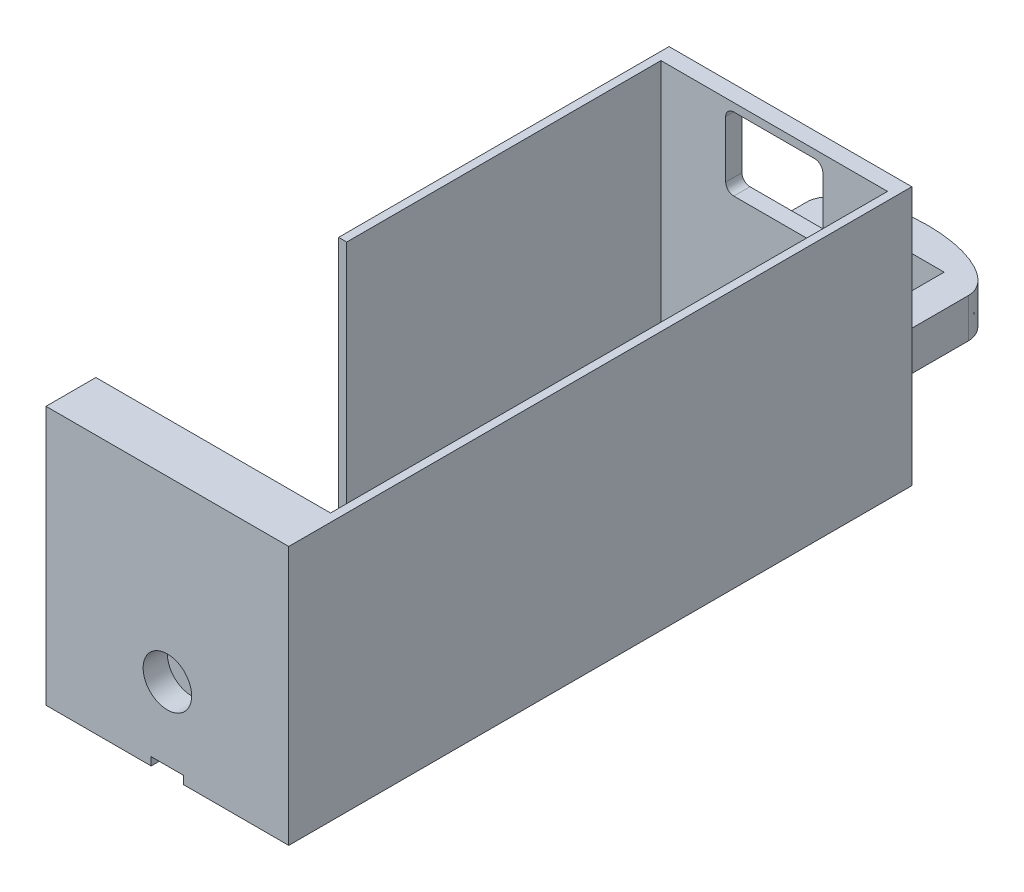
from build123d import *

# Parameters (mm, degrees)
ESQUISSE1_W              = 30
ESQUISSE1_H              = 32
BOSS_EXTRU_2_DEPTH       = 77
ESQUISSE2_W              = 28
ESQUISSE2_H              = 68.8370016
ENL_V_MAT_EXTRU_4_DEPTH  = 30
ESQUISSE3_W              = 12
ESQUISSE3_H              = 9
ENL_V_MAT_EXTRU_5_DEPTH  = 87.884981441
ESQUISSE5_W              = 20
ESQUISSE5_H              = 4.856303455
BOSS_EXTRU_3_DEPTH       = 16
ESQUISSE6_W              = 12
ESQUISSE6_H              = 12
ENL_V_MAT_EXTRU_6_DEPTH  = 6
ESQUISSE7_W              = 30
ESQUISSE7_H              = 30
ENL_V_MAT_EXTRU_7_DEPTH  = 6
CONG_3_SIZE              = 5
CONG_3_SIZE_2            = 10
CONG_5_SIZE              = 5
CONG_5_SIZE_2            = 10
ESQUISSE10_W             = 4
ESQUISSE10_H             = 1
ENL_V_MAT_EXTRU_9_DEPTH  = 89.617154096
ESQUISSE16_R             = 3
ENL_V_MAT_EXTRU_11_DEPTH = 3
CONG_7_R                 = 1


with BuildPart() as part:
    # Esquisse1 → Boss.-Extru.2 (new body)
    with BuildSketch(Plane.XY):
        with Locations((15, 16)):
            Rectangle(ESQUISSE1_W, ESQUISSE1_H)
    extrude(amount=BOSS_EXTRU_2_DEPTH)

    # Esquisse2 → Enlèv. mat.-Extru.4 (cut)
    with BuildSketch(Plane(origin=(0, 32, 0), x_dir=(1, 0, 0), z_dir=(0, 1, 0))):
        with Locations((15, -36.4185008)):
            Rectangle(ESQUISSE2_W, ESQUISSE2_H)
    extrude(amount=-ENL_V_MAT_EXTRU_4_DEPTH, mode=Mode.SUBTRACT)

    # Esquisse3 → Enlèv. mat.-Extru.5 (cut, through all)
    with BuildSketch(Plane.XY.offset(2)):
        with Locations((15, 26.5)):
            Rectangle(ESQUISSE3_W, ESQUISSE3_H)
    extrude(amount=-ENL_V_MAT_EXTRU_5_DEPTH, mode=Mode.SUBTRACT)

    # Esquisse5 → Boss.-Extru.3 (add)
    with BuildSketch(Plane(origin=(0, 0, 0), x_dir=(-1, 0, 0), z_dir=(0, 0, -1))):
        with Locations((-16, 10.428151728)):
            Rectangle(ESQUISSE5_W, ESQUISSE5_H)
    extrude(amount=BOSS_EXTRU_3_DEPTH)

    # Esquisse6 → Enlèv. mat.-Extru.6 (cut)
    with BuildSketch(Plane(origin=(0, 12.856303455, 0), x_dir=(1, 0, 0), z_dir=(0, 1, 0))):
        with Locations((16, 6)):
            Rectangle(ESQUISSE6_W, ESQUISSE6_H)
    extrude(amount=-ENL_V_MAT_EXTRU_6_DEPTH, mode=Mode.SUBTRACT)

    # Esquisse7 → Enlèv. mat.-Extru.7 (cut)
    with BuildSketch(Plane.ZY):
        with Locations((55.8370016, 17)):
            Rectangle(ESQUISSE7_W, ESQUISSE7_H)
    extrude(amount=-ENL_V_MAT_EXTRU_7_DEPTH, mode=Mode.SUBTRACT)

    # Congé3
    # a fillet whose section is not a circle: 10, 5 mm, written as the material it takes off along each edge
    with BuildSketch(Plane(origin=(6, -17, -16), x_dir=(0, 0, 1), z_dir=(0, 1, 0))) as cong_3_piece_1:
        with BuildLine():
            Bezier((CONG_3_SIZE, 0), (0, 0), (0, CONG_3_SIZE_2), weights=[1, 0.707106781, 1])
            Line((0, CONG_3_SIZE_2), (0, 0))
            Line((0, 0), (CONG_3_SIZE, 0))
        make_face()
    extrude(amount=54.856303455, mode=Mode.SUBTRACT)

    # Congé5
    # a fillet whose section is not a circle: 10, 5 mm, written as the material it takes off along each edge
    with BuildSketch(Plane(origin=(26, 37.856303455, -16), x_dir=(0, 0, 1), z_dir=(0, -1, 0))) as cong_5_piece_1:
        with BuildLine():
            Bezier((CONG_5_SIZE, 0), (0, 0), (0, CONG_5_SIZE_2), weights=[1, 0.707106781, 1])
            Line((0, CONG_5_SIZE_2), (0, 0))
            Line((0, 0), (CONG_5_SIZE, 0))
        make_face()
    extrude(amount=54.856303455, mode=Mode.SUBTRACT)

    # Esquisse10 → Enlèv. mat.-Extru.9 (cut, through all)
    with BuildSketch(Plane(origin=(0, 0, 0), x_dir=(-1, 0, 0), z_dir=(0, 0, -1))):
        with Locations((-15, 0.5)):
            Rectangle(ESQUISSE10_W, ESQUISSE10_H)
    extrude(amount=-ENL_V_MAT_EXTRU_9_DEPTH, mode=Mode.SUBTRACT)

    # Esquisse16 → Enlèv. mat.-Extru.11 (cut)
    with BuildSketch(Plane.XY.offset(77)):
        with Locations((15, 10)):
            Circle(ESQUISSE16_R)
    extrude(amount=-ENL_V_MAT_EXTRU_11_DEPTH, mode=Mode.SUBTRACT)

    # Congé7
    cong_7_edges = [part.edges().sort_by_distance(p)[0] for p in [
        (21, 31, 1),
        (21, 22, 1),
        (9, 22, 1),
        (9, 31, 1),
    ]]
    fillet(cong_7_edges, radius=CONG_7_R)


solid = part.part
